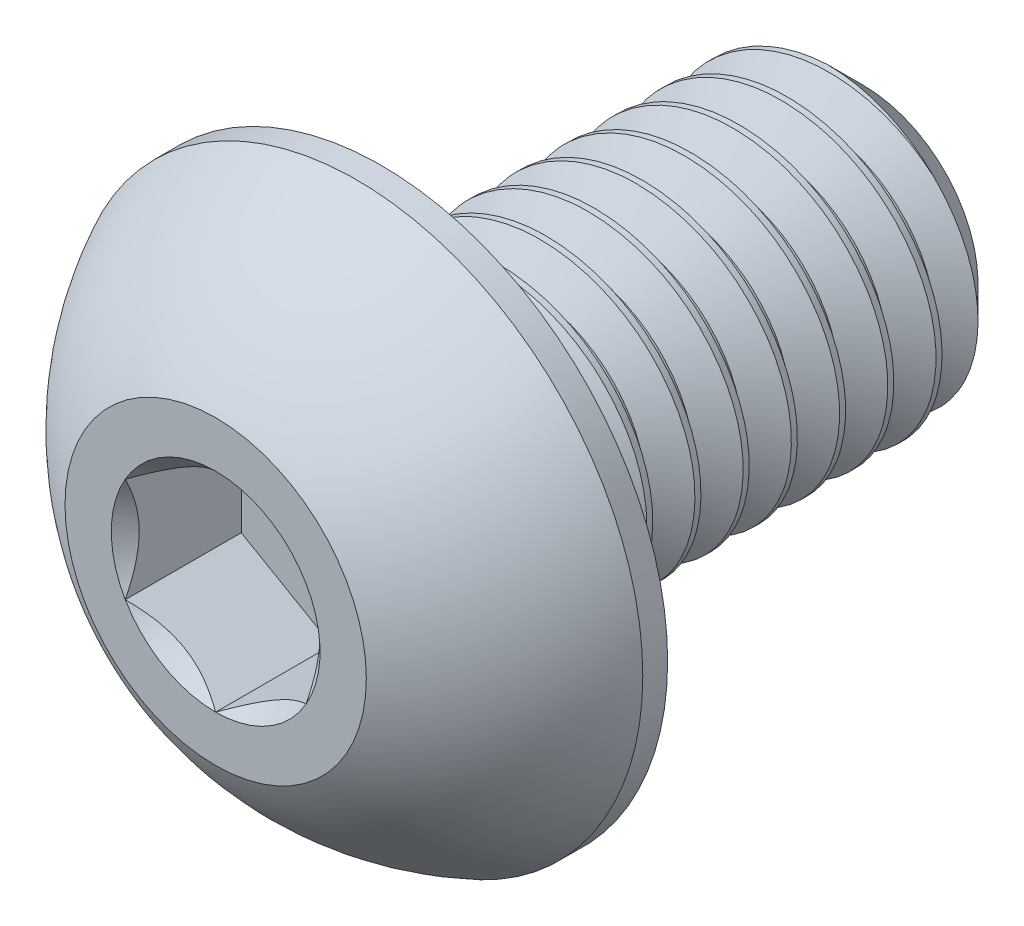
from build123d import *

# Parameters (mm, degrees)
SKETCH1_W          = 8
SKETCH1_H          = 2.5
CHAMFER1_SIZE      = 0.6
CUT_EXTRUDE2_DEPTH = 1.925
CUT_SWEEP1_PITCH   = 0.8


with BuildPart() as part:
    # Sketch1 → Revolve1 (revolve)
    with BuildSketch(Plane(origin=(0, 0, 0), x_dir=(0, 0, -1), z_dir=(1, 0, 0))):
        with Locations((6.75, 1.25)):
            Rectangle(SKETCH1_W, SKETCH1_H)
    revolve(axis=Axis((0, 0, -10.75), (0, 0, 1)))

    # Chamfer1
    chamfer1_edges = [part.edges().sort_by_distance(p)[0] for p in [
        (0, -2.5, -10.75),
    ]]
    chamfer(chamfer1_edges, length=CHAMFER1_SIZE)

    # Sketch7 → Revolve2 (revolve)
    with BuildSketch(Plane(origin=(0, 0, 0), x_dir=(0, 0, -1), z_dir=(1, 0, 0)), mode=Mode.PRIVATE) as revolve2_sk:
        with BuildLine():
            Line((2.3375, 4.75), (2.75, 4.75))
            Line((2.75, 4.75), (2.75, 0))
            Line((2.75, 0), (0, 0))
            Line((0, 0), (0, 2.5))
            ThreePointArc((0, 2.5), (0.991875183, 3.808753282), (2.3375, 4.75))
        make_face()
    revolve(revolve2_sk.sketch.rotate(Axis((0, 0, 0), (0, 0, -1)), 180), axis=Axis((0, 0, 0), (0, 0, -1)))

    # Sketch5 → Cut-Extrude2 (cut)
    with BuildSketch(Plane.XY):
        Polygon((1.5, -0.866025404), (1.5, 0.866025404), (0, 1.732050808), (-1.5, 0.866025404), (-1.5, -0.866025404), (0, -1.732050808), align=None)
    extrude(amount=-CUT_EXTRUDE2_DEPTH, mode=Mode.SUBTRACT)

    # Cut-Extrude3 cone 1 section (through the dimple's axis) → Cut-Extrude3 (revolve, cut)
    with BuildSketch(Plane(origin=(0, 0, 0), x_dir=(0, -1, 0), z_dir=(1, 0, 0))):
        Polygon((0, 0), (1.732050808, 0), (0, 1.732050808), align=None)
    revolve(axis=Axis((0, 0, 0), (0, 0, -1)), mode=Mode.SUBTRACT)

    # Cut-Sweep1: the profile of Sketch2 profile screwed along a right-hand helix of 11 turns, 8 arcs to a turn; built about Z, then put on its axis
    cut_sweep1_z = Axis((0, 0, 0), (0, 0, 1))
    cut_sweep1_corners = [(2.5003, 0, 0.600173205), (2.5003, 0, -0.100173205), (1.980384758, 0, 0.2), (1.980384758, 0, 0.3)]
    with BuildLine(mode=Mode.PRIVATE) as cut_sweep1_profile:
        Line(cut_sweep1_corners[0], cut_sweep1_corners[1])
        Line(cut_sweep1_corners[1], cut_sweep1_corners[2])
        Line(cut_sweep1_corners[2], cut_sweep1_corners[3])
        Line(cut_sweep1_corners[3], cut_sweep1_corners[0])
    cut_sweep1_cap = Face(cut_sweep1_profile.wire())
    cut_sweep1_turn_angles = [0, 22.5, 45, 67.5, 90, 112.5, 135, 157.5, 180, 202.5, 225, 247.5, 270, 292.5, 315, 337.5, 360]
    cut_sweep1_turn_weights = [1, 0.9238795325112867, 1, 0.9238795325112867, 1, 0.9238795325112867, 1, 0.9238795325112867, 1, 0.9238795325112867, 1, 0.9238795325112867, 1, 0.9238795325112867, 1, 0.9238795325112867, 1]
    cut_sweep1_turn_rails = [Edge.make_bspline([Vector(p[0], p[1], 0).rotate(cut_sweep1_z, cut_sweep1_turn_angles[k]) / cut_sweep1_turn_weights[k] + Vector(0, 0, p[2] + CUT_SWEEP1_PITCH * cut_sweep1_turn_angles[k] / 360) for k in range(17)], [0, 0, 0, 1, 1, 2, 2, 3, 3, 4, 4, 5, 5, 6, 6, 7, 7, 8, 8, 8], 2, cut_sweep1_turn_weights) for p in cut_sweep1_corners]
    cut_sweep1_turn_sides = [Face.make_surface_from_curves(cut_sweep1_turn_rails[p[0]], cut_sweep1_turn_rails[p[1]]) for p in [(0, 1), (1, 2), (2, 3), (3, 0)]]
    cut_sweep1 = Plane(origin=(0, 0, -10.75), x_dir=(0, 1, 0), z_dir=(0, 0, 1)) * Solid(Shell([*[p.moved(Location((0, 0, CUT_SWEEP1_PITCH * i))) for i in range(11) for p in cut_sweep1_turn_sides], cut_sweep1_cap, cut_sweep1_cap.rotate(cut_sweep1_z, 3960).moved(Location((0, 0, CUT_SWEEP1_PITCH * 3960 / 360)))]))
    add(cut_sweep1, mode=Mode.SUBTRACT)


solid = part.part
